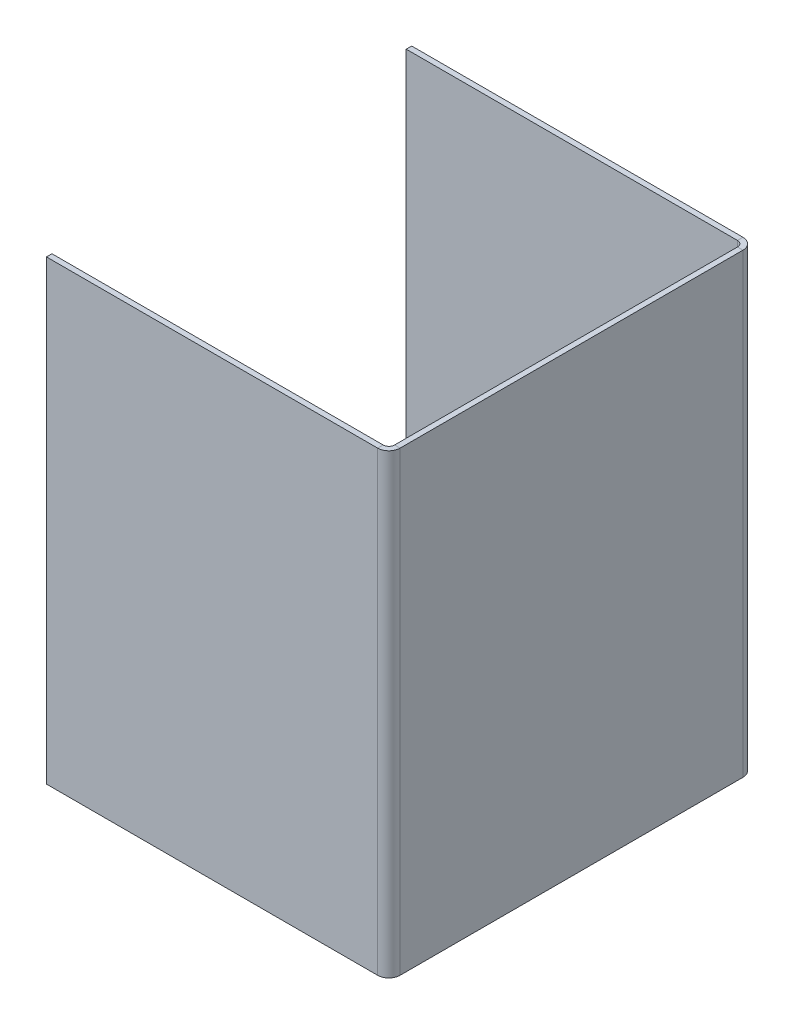
from build123d import *

# Parameters (mm, degrees)
SKETCH1_W                    = 81.28
SKETCH1_H                    = 101.6
BASE_FLANGE1_DEPTH           = 1.2192
EDGE_FLANGE1_STRIP_W         = 7.4168
EDGE_FLANGE1_STRIP_H         = 1.2192
EDGE_FLANGE1_STRIP_CUT_DEPTH = 101.6
EDGE_FLANGE1_DEPTH           = 101.6
EDGE_FLANGE2_STRIP_W         = 7.4168
EDGE_FLANGE2_STRIP_H         = 1.2192
EDGE_FLANGE2_STRIP_CUT_DEPTH = 101.6
EDGE_FLANGE2_DEPTH           = 101.6


# Sheet-metal steps are written as plain solids
with BuildPart() as part:
    # Sketch1 → Base-Flange1 (new body)
    with BuildSketch(Plane(origin=(0, 0, 0), x_dir=(0, 0, -1), z_dir=(1, 0, 0))):
        with Locations((40.64, 50.8)):
            Rectangle(SKETCH1_W, SKETCH1_H)
    extrude(amount=-BASE_FLANGE1_DEPTH)

    # Edge-Flange1 strip (across the edge) → Edge-Flange1 strip cut (cut)
    with BuildSketch(Plane(origin=(-1.2192, 0, 0), x_dir=(0, 0, -1), z_dir=(0, 1, 0))):
        with Locations((-1.2192, -0.6096)):
            Rectangle(EDGE_FLANGE1_STRIP_W, EDGE_FLANGE1_STRIP_H)
    extrude(amount=EDGE_FLANGE1_STRIP_CUT_DEPTH, mode=Mode.SUBTRACT)

    # Edge-Flange1 section (across the edge) → Edge-Flange1 (add)
    with BuildSketch(Plane(origin=(-1.2192, 0, 0), x_dir=(0, 0, -1), z_dir=(0, 1, 0))):
        with BuildLine():
            Line((0, 1.27), (0, 74.9808))
            Line((0, 74.9808), (1.2192, 74.9808))
            Line((1.2192, 74.9808), (1.2192, 1.27))
            ThreePointArc((1.2192, 1.27), (1.591174388, 0.371974388), (2.4892, 0))
            Line((2.4892, 0), (2.4892, -1.2192))
            ThreePointArc((2.4892, -1.2192), (0.7290698, -0.4901302), (0, 1.27))
        make_face()
    extrude(amount=EDGE_FLANGE1_DEPTH)

    # Edge-Flange2 strip (across the edge) → Edge-Flange2 strip cut (cut)
    with BuildSketch(Plane(origin=(-1.2192, 101.6, -81.28), x_dir=(0, 0, 1), z_dir=(0, -1, 0))):
        with Locations((-1.2192, -0.6096)):
            Rectangle(EDGE_FLANGE2_STRIP_W, EDGE_FLANGE2_STRIP_H)
    extrude(amount=EDGE_FLANGE2_STRIP_CUT_DEPTH, mode=Mode.SUBTRACT)

    # Edge-Flange2 section (across the edge) → Edge-Flange2 (add)
    with BuildSketch(Plane(origin=(-1.2192, 101.6, -81.28), x_dir=(0, 0, 1), z_dir=(0, -1, 0))):
        with BuildLine():
            Line((0, 1.27), (0, 74.9808))
            Line((0, 74.9808), (1.2192, 74.9808))
            Line((1.2192, 74.9808), (1.2192, 1.27))
            ThreePointArc((1.2192, 1.27), (1.591174388, 0.371974388), (2.4892, 0))
            Line((2.4892, 0), (2.4892, -1.2192))
            ThreePointArc((2.4892, -1.2192), (0.7290698, -0.4901302), (0, 1.27))
        make_face()
    extrude(amount=EDGE_FLANGE2_DEPTH)


solid = part.part
